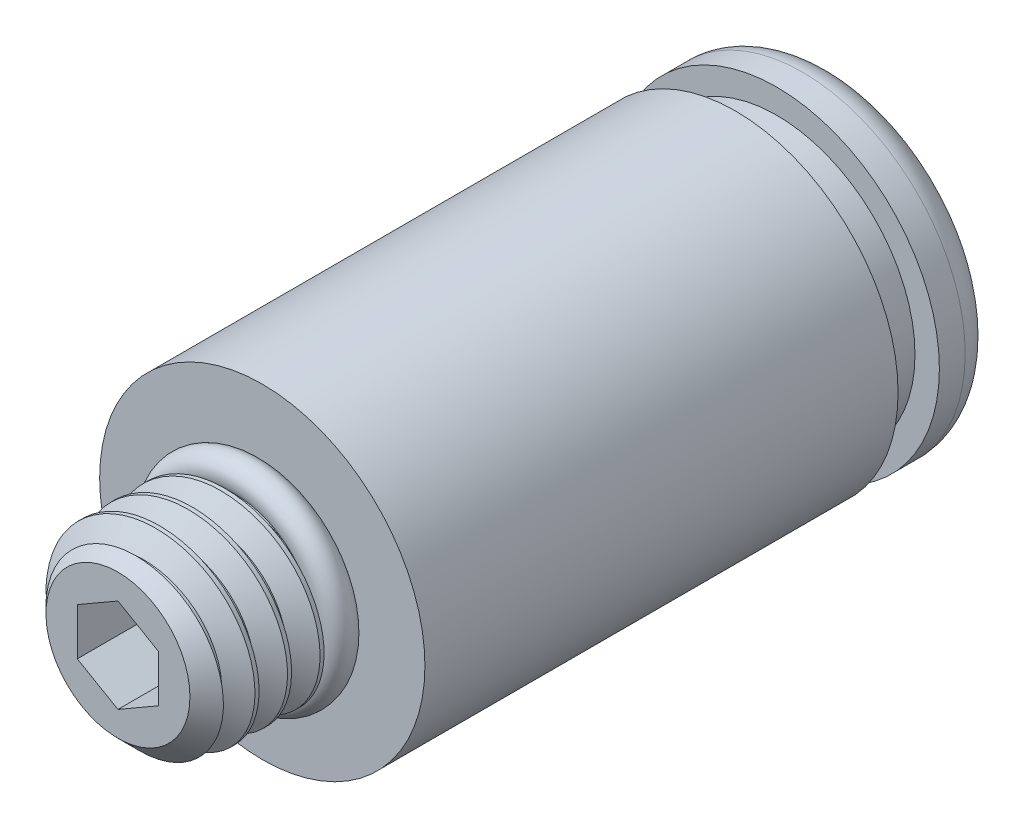
from build123d import *

# Parameters (mm, degrees)
SKETCH1_R           = 2.366119099
EXTRUDE1_DEPTH      = 4.3
CUT_SWEEP1_PITCH    = 0.8
SKETCH12_R          = 4
BOSS_EXTRUDE1_DEPTH = 0.75
SKETCH13_R          = 0.375
SKETCH11_R          = 2
CUT_EXTRUDE4_DEPTH  = 13.3
CUT_EXTRUDE1_DEPTH  = 15.45302742


with BuildPart() as part:
    # Sketch1 → Extrude1 (new body)
    with BuildSketch(Plane.XY):
        Circle(SKETCH1_R)
    extrude(amount=-EXTRUDE1_DEPTH)

    # Cut-Sweep1: the profile of Sketch3 screwed along a right-hand helix of 16.56715 turns, 6 arcs to a turn; built about Z, then put on its axis
    cut_sweep1_z = Axis((0, 0, 0), (0, 0, 1))
    cut_sweep1_corners = [(1.846503857, 0, -0.4), (1.846503857, 0, -0.3), (2.45272164, 0, 0.05), (2.40942037, 0, -0.725)]
    with BuildLine(mode=Mode.PRIVATE) as cut_sweep1_profile:
        Line(cut_sweep1_corners[0], cut_sweep1_corners[1])
        Line(cut_sweep1_corners[1], cut_sweep1_corners[2])
        Line(cut_sweep1_corners[2], cut_sweep1_corners[3])
        Line(cut_sweep1_corners[3], cut_sweep1_corners[0])
    cut_sweep1_cap = Face(cut_sweep1_profile.wire())
    cut_sweep1_turn_angles = [0, 30, 60, 90, 120, 150, 180, 210, 240, 270, 300, 330, 360]
    cut_sweep1_turn_weights = [1, 0.8660254037844387, 1, 0.8660254037844387, 1, 0.8660254037844387, 1, 0.8660254037844387, 1, 0.8660254037844387, 1, 0.8660254037844387, 1]
    cut_sweep1_turn_rails = [Edge.make_bspline([Vector(p[0], p[1], 0).rotate(cut_sweep1_z, cut_sweep1_turn_angles[k]) / cut_sweep1_turn_weights[k] + Vector(0, 0, p[2] + CUT_SWEEP1_PITCH * cut_sweep1_turn_angles[k] / 360) for k in range(13)], [0, 0, 0, 1, 1, 2, 2, 3, 3, 4, 4, 5, 5, 6, 6, 6], 2, cut_sweep1_turn_weights) for p in cut_sweep1_corners]
    cut_sweep1_turn_sides = [Face.make_surface_from_curves(cut_sweep1_turn_rails[p[0]], cut_sweep1_turn_rails[p[1]]) for p in [(0, 1), (1, 2), (2, 3), (3, 0)]]
    cut_sweep1_last_angles = [5760, 5790, 5820, 5850, 5880, 5910, 5940, 5952.087, 5964.174]
    cut_sweep1_last_weights = [1, 0.8660254037844387, 1, 0.8660254037844387, 1, 0.8660254037844387, 1, 0.9778307725331156, 1]
    cut_sweep1_last_rails = [Edge.make_bspline([Vector(p[0], p[1], 0).rotate(cut_sweep1_z, cut_sweep1_last_angles[k]) / cut_sweep1_last_weights[k] + Vector(0, 0, p[2] + CUT_SWEEP1_PITCH * cut_sweep1_last_angles[k] / 360) for k in range(9)], [0, 0, 0, 1, 1, 2, 2, 3, 3, 4, 4, 4], 2, cut_sweep1_last_weights) for p in cut_sweep1_corners]
    cut_sweep1_last_sides = [Face.make_surface_from_curves(cut_sweep1_last_rails[p[0]], cut_sweep1_last_rails[p[1]]) for p in [(0, 1), (1, 2), (2, 3), (3, 0)]]
    cut_sweep1 = Plane(origin=(0, 0, 0), x_dir=(0, 1, 0), z_dir=(0, 0, -1)) * Solid(Shell([*[p.moved(Location((0, 0, CUT_SWEEP1_PITCH * i))) for i in range(16) for p in cut_sweep1_turn_sides], *cut_sweep1_last_sides, cut_sweep1_cap, cut_sweep1_cap.rotate(cut_sweep1_z, 5964.174).moved(Location((0, 0, CUT_SWEEP1_PITCH * 5964.174 / 360)))]))
    add(cut_sweep1, mode=Mode.SUBTRACT)

    # Sketch4 → Cut-Revolve1 (revolve, cut)
    with BuildSketch(Plane(origin=(0, 0, 0), x_dir=(0, 0, -1), z_dir=(1, 0, 0)), mode=Mode.PRIVATE) as cut_revolve1_sk:
        Polygon((4.3, 1.879771425), (3.5, 1.879771425), (2.79472564, 2.585045786), (4.3, 2.585045786), align=None)
        Polygon((0.814247186, 2.585045786), (0, 1.770798599), (0, 2.585045786), align=None)
    revolve(cut_revolve1_sk.sketch.rotate(Axis((0, 0, 0), (0, 0, -1)), 267.988719977), axis=Axis((0, 0, 0), (0, 0, -1)), mode=Mode.SUBTRACT)

    # Sketch8 → Revolve1 (revolve)
    with BuildSketch(Plane(origin=(0, 0, 0), x_dir=(0, 0, -1), z_dir=(1, 0, 0)), mode=Mode.PRIVATE) as revolve1_sk:
        with BuildLine():
            Line((16.203, 4), (16.838, 4))
            ThreePointArc((16.838, 4), (17.376815367, 3.776815367), (17.6, 3.238))
            Line((17.6, 3.238), (17.6, 2.381))
            Line((17.6, 2.381), (17.219, 2))
            Line((17.219, 2), (17.219, 0))
            Line((17.219, 0), (4.3, 0))
            Line((4.3, 0), (4.3, 2))
            Line((4.3, 2), (4.3, 4))
            Line((4.3, 4), (15.187, 4))
            Line((15.187, 4), (15.187, 3.4))
            Line((15.187, 3.4), (16.203, 3.4))
            Line((16.203, 3.4), (16.203, 4))
        make_face()
    revolve(revolve1_sk.sketch.rotate(Axis((0, 0, 0), (0, 0, -1)), 90), axis=Axis((0, 0, 0), (0, 0, -1)))

    # Sketch12 → Boss-Extrude1 (add)
    with BuildSketch(Plane.XY.offset(-4.3)):
        Circle(SKETCH12_R)
    extrude(amount=BOSS_EXTRUDE1_DEPTH)

    # Sketch11 → Cut-Extrude4 (cut)
    with BuildSketch(Plane(origin=(0, 0, -17.6), x_dir=(-1, 0, 0), z_dir=(0, 0, -1))):
        Circle(SKETCH11_R)
    extrude(amount=-CUT_EXTRUDE4_DEPTH, mode=Mode.SUBTRACT)

    # Sketch9 → Cut-Extrude1 (cut, through all)
    with BuildSketch(Plane(origin=(0, 0, -4.3), x_dir=(-1, 0, 0), z_dir=(0, 0, -1))):
        Polygon((0, 1.154700538), (-1, 0.577350269), (-1, -0.577350269), (0, -1.154700538), (1, -0.577350269), (1, 0.577350269), align=None)
    extrude(amount=-CUT_EXTRUDE1_DEPTH, mode=Mode.SUBTRACT)


with BuildPart() as body_2:
    # Sketch13 → Revolve3 (revolve)
    with BuildSketch(Plane(origin=(0, 0, 0), x_dir=(0, 0, -1), z_dir=(1, 0, 0)), mode=Mode.PRIVATE) as revolve3_sk:
        with Locations((3.175, 2.221503857)):
            Circle(SKETCH13_R)
    revolve(revolve3_sk.sketch.rotate(Axis((0, 0, 0), (0, 0, -1)), 90), axis=Axis((0, 0, 0), (0, 0, -1)))


solid = Compound([part.part, body_2.part])
